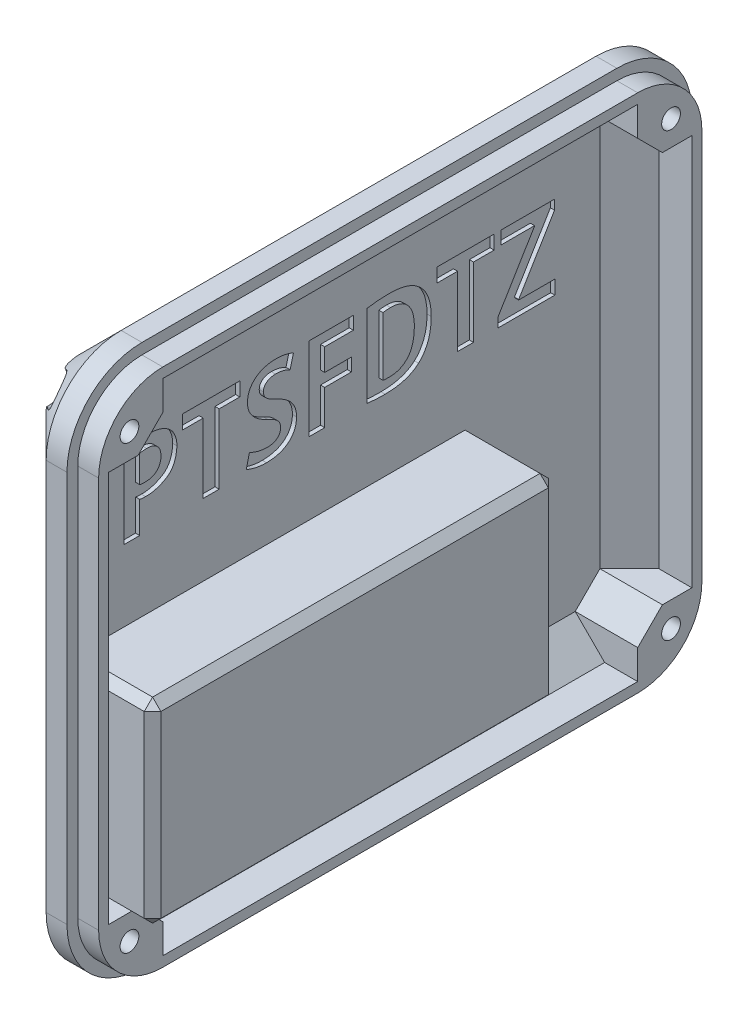
from build123d import *

# Parameters (mm, degrees)
EXTRUDE_4_DEPTH     = 15
CHAMFER_2_SIZE      = 10
SHELL_3_T           = -5
EXTRUDE_5_DEPTH     = 5
EXTRUDE_6_REACH     = 103.242
SKETCH_6_R          = 2.25
CUT_EXTRUDE_1_DEPTH = 43
SKETCH_7_R          = 3.75
CUT_EXTRUDE_2_DEPTH = 16
FILLET_1_R          = 2
SKETCH_8_W          = 93
SKETCH_8_H          = 43
CUT_EXTRUDE_3_DEPTH = 16
SKETCH_12_W         = 97
SKETCH_12_H         = 47
SKETCH_12_W_2       = 93
SKETCH_12_H_2       = 43
EXTRUDE_7_DEPTH     = 18
SKETCH_14_W         = 97
SKETCH_14_H         = 47
EXTRUDE_8_DEPTH     = 2
CHAMFER_4_SIZE      = 2
SKETCH_15_W         = 8
SKETCH_15_H         = 8
CUT_EXTRUDE_4_DEPTH = 3
FILLET_2_R          = 4
CUT_EXTRUDE_5_DEPTH = 1
SKETCH_18_R         = 5
CUT_EXTRUDE_6_DEPTH = 10


with BuildPart() as part:
    # 草图3 → 凸台-拉伸4 (new body)
    with BuildSketch(Plane(origin=(0, 0, 0), x_dir=(0, 0, -1), z_dir=(1, 0, 0))):
        with BuildLine():
            Line((-57, -65), (57, -65))
            ThreePointArc((57, -65), (69.727922061, -59.727922061), (75, -47))
            Line((75, -47), (75, 47))
            ThreePointArc((75, 47), (69.727922061, 59.727922061), (57, 65))
            Line((57, 65), (-57, 65))
            ThreePointArc((-57, 65), (-69.727922061, 59.727922061), (-75, 47))
            Line((-75, 47), (-75, -47))
            ThreePointArc((-75, -47), (-69.727922061, -59.727922061), (-57, -65))
        make_face()
    extrude(amount=EXTRUDE_4_DEPTH)

    # 倒角2
    chamfer_2_edges = [part.edges().sort_by_distance(p)[0] for p in [
        (0, 65, 0),
        (0, 59.727922061, -69.727922061),
        (0, 0, -75),
        (0, -59.727922061, -69.727922061),
        (0, -65, 0),
        (0, -59.727922061, 69.727922061),
        (0, 0, 75),
        (0, 59.727922061, 69.727922061),
    ]]
    chamfer(chamfer_2_edges, length=CHAMFER_2_SIZE)

    # 抽壳3
    shell_3_openings = [part.faces().sort_by_distance(p)[0] for p in [
        (15, 0, 0),
    ]]
    offset(amount=SHELL_3_T, openings=shell_3_openings, kind=Kind.INTERSECTION)

    # 草图4 → 凸台-拉伸5 (add)
    with BuildSketch(Plane(origin=(15, 0, 0), x_dir=(0, 0, -1), z_dir=(1, 0, 0))):
        with BuildLine():
            Line((72.4, -47), (72.4, 47))
            ThreePointArc((72.4, 47), (67.88944443, 57.88944443), (57, 62.4))
            Line((57, 62.4), (-57, 62.4))
            ThreePointArc((-57, 62.4), (-67.88944443, 57.88944443), (-72.4, 47))
            Line((-72.4, 47), (-72.4, -47))
            ThreePointArc((-72.4, -47), (-67.88944443, -57.88944443), (-57, -62.4))
            Line((-57, -62.4), (57, -62.4))
            ThreePointArc((57, -62.4), (67.88944443, -57.88944443), (72.4, -47))
        make_face()
        with BuildLine():
            Line((70, -47), (70, 47))
            ThreePointArc((70, 47), (66.192388155, 56.192388155), (57, 60))
            Line((57, 60), (-57, 60))
            ThreePointArc((-57, 60), (-66.192388155, 56.192388155), (-70, 47))
            Line((-70, 47), (-70, -47))
            ThreePointArc((-70, -47), (-66.192388155, -56.192388155), (-57, -60))
            Line((-57, -60), (57, -60))
            ThreePointArc((57, -60), (66.192388155, -56.192388155), (70, -47))
        make_face(mode=Mode.SUBTRACT)
    extrude(amount=EXTRUDE_5_DEPTH)

    # 草图5 → 凸台-拉伸6 (add, up to next)
    with BuildSketch(Plane(origin=(20, 0, 0), x_dir=(0, 0, -1), z_dir=(1, 0, 0)), mode=Mode.PRIVATE) as extrude_6_sk1:
        with BuildLine():
            Line((-57, 52.928932188), (-62.928932188, 47))
            Line((-62.928932188, 47), (-70, 47))
            ThreePointArc((-70, 47), (-66.192388155, 56.192388155), (-57, 60))
            Line((-57, 60), (-57, 52.928932188))
        make_face()
    extrude_6_tool1 = extrude(extrude_6_sk1.sketch, amount=-EXTRUDE_6_REACH, mode=Mode.PRIVATE) - part.part
    # 草图5 → 凸台-拉伸6 (add, up to next)
    with BuildSketch(Plane(origin=(20, 0, 0), x_dir=(0, 0, -1), z_dir=(1, 0, 0)), mode=Mode.PRIVATE) as extrude_6_sk2:
        with BuildLine():
            Line((57, 60), (57, 52.928932188))
            Line((57, 52.928932188), (62.928932188, 47))
            Line((62.928932188, 47), (70, 47))
            ThreePointArc((70, 47), (66.192388155, 56.192388155), (57, 60))
        make_face()
    extrude_6_tool2 = extrude(extrude_6_sk2.sketch, amount=-EXTRUDE_6_REACH, mode=Mode.PRIVATE) - part.part
    # 草图5 → 凸台-拉伸6 (add, up to next)
    with BuildSketch(Plane(origin=(20, 0, 0), x_dir=(0, 0, -1), z_dir=(1, 0, 0)), mode=Mode.PRIVATE) as extrude_6_sk3:
        with BuildLine():
            Line((62.928932188, -47), (70, -47))
            ThreePointArc((70, -47), (66.192388155, -56.192388155), (57, -60))
            Line((57, -60), (57, -52.928932188))
            Line((57, -52.928932188), (62.928932188, -47))
        make_face()
    extrude_6_tool3 = extrude(extrude_6_sk3.sketch, amount=-EXTRUDE_6_REACH, mode=Mode.PRIVATE) - part.part
    # 草图5 → 凸台-拉伸6 (add, up to next)
    with BuildSketch(Plane(origin=(20, 0, 0), x_dir=(0, 0, -1), z_dir=(1, 0, 0)), mode=Mode.PRIVATE) as extrude_6_sk4:
        with BuildLine():
            Line((-57, -60), (-57, -52.928932188))
            Line((-57, -52.928932188), (-62.928932188, -47))
            Line((-62.928932188, -47), (-70, -47))
            ThreePointArc((-70, -47), (-66.192388155, -56.192388155), (-57, -60))
        make_face()
    extrude_6_tool4 = extrude(extrude_6_sk4.sketch, amount=-EXTRUDE_6_REACH, mode=Mode.PRIVATE) - part.part
    add(extrude_6_tool1.solids().sort_by_distance((20, 53.057838, 63.057838))[0])
    add(extrude_6_tool2.solids().sort_by_distance((20, 53.057838, -63.057838))[0])
    add(extrude_6_tool3.solids().sort_by_distance((20, -53.057838, -63.057838))[0])
    add(extrude_6_tool4.solids().sort_by_distance((20, -53.057838, 63.057838))[0])

    # 草图6 → 切除-拉伸1 (cut)
    with BuildSketch(Plane(origin=(20, 0, 0), x_dir=(0, 0, -1), z_dir=(1, 0, 0))):
        with Locations((65, 53)):
            Circle(SKETCH_6_R)
        with Locations(Location((-65, 53, 0), (0, 0, 347.276950351))):
            Circle(SKETCH_6_R)
        with Locations(Location((65, -53, 0), (0, 0, 118.983255922))):
            Circle(SKETCH_6_R)
        with Locations((-65, -53)):
            Circle(SKETCH_6_R)
    extrude(amount=-CUT_EXTRUDE_1_DEPTH, mode=Mode.SUBTRACT)

    # 草图7 → 切除-拉伸2 (cut)
    with BuildSketch(Plane.ZY):
        with Locations((65, 53)):
            Circle(SKETCH_7_R)
        with Locations(Location((-65, 53, 0), (0, 0, 11.255696593))):
            Circle(SKETCH_7_R)
        with Locations((-65, -53)):
            Circle(SKETCH_7_R)
        with Locations(Location((65, -53, 0), (0, 0, 95.004507954))):
            Circle(SKETCH_7_R)
    extrude(amount=-CUT_EXTRUDE_2_DEPTH, mode=Mode.SUBTRACT)

    # 圆角1
    fillet_1_edges = [part.edges().sort_by_distance(p)[0] for p in [
        (0, -50.75, 62),
        (0, -50.466645488, -62.235110324),
        (0, 50.749999996, -62.000000003),
        (0, 50.75, 62),
    ]]
    fillet(fillet_1_edges, radius=FILLET_1_R)

    # 草图8 → 切除-拉伸3 (cut)
    with BuildSketch(Plane.ZY):
        with Locations((15.948862223, -25.5)):
            Rectangle(SKETCH_8_W, SKETCH_8_H)
    extrude(amount=-CUT_EXTRUDE_3_DEPTH, mode=Mode.SUBTRACT)

    # 草图12 → 凸台-拉伸7 (add)
    with BuildSketch(Plane(origin=(5, 0, 0), x_dir=(0, 0, -1), z_dir=(1, 0, 0))):
        with Locations((-15.948862223, -25.5)):
            Rectangle(SKETCH_12_W, SKETCH_12_H)
        with Locations((-15.948862223, -25.5)):
            Rectangle(SKETCH_12_W_2, SKETCH_12_H_2, mode=Mode.SUBTRACT)
    extrude(amount=EXTRUDE_7_DEPTH)

    # 草图14 → 凸台-拉伸8 (add)
    with BuildSketch(Plane(origin=(23, 0, 0), x_dir=(0, 0, -1), z_dir=(1, 0, 0))):
        with Locations((-15.948862223, -25.5)):
            Rectangle(SKETCH_14_W, SKETCH_14_H)
    extrude(amount=EXTRUDE_8_DEPTH)

    # 倒角4
    chamfer_4_edges = [part.edges().sort_by_distance(p)[0] for p in [
        (25, -2, 15.948862223),
        (15, -2, -32.551137777),
        (25, -25.5, -32.551137777),
        (15, -49, -32.551137777),
        (25, -49, 15.948862223),
        (22.5, -49, 64.448862223),
        (25, -25.5, 64.448862223),
        (15.759965017, -2, 64.448862223),
    ]]
    chamfer(chamfer_4_edges, length=CHAMFER_4_SIZE)

    # 草图15 → 切除-拉伸4 (cut)
    with BuildSketch(Plane.ZY):
        with Locations((-26.551137777, 0)):
            Rectangle(SKETCH_15_W, SKETCH_15_H)
        with Locations((-26.551137777, -51)):
            Rectangle(SKETCH_15_W, SKETCH_15_H)
        with Locations((58.448862223, 0)):
            Rectangle(SKETCH_15_W, SKETCH_15_H)
    extrude(amount=-CUT_EXTRUDE_4_DEPTH, mode=Mode.SUBTRACT)

    # 圆角2
    fillet_2_edges = [part.edges().sort_by_distance(p)[0] for p in [
        (1.5, 4, 62.448862223),
        (1.5, 4, 54.448862223),
        (1.5, -55, -22.551137777),
        (1.5, -55, -30.551137777),
        (1.5, 4, -22.551137777),
        (1.5, 4, -30.551137777),
    ]]
    fillet(fillet_2_edges, radius=FILLET_2_R - 0.0001)  # a hair under: the kernel refuses the full size

    # 草图17 → 切除-拉伸5 (cut)
    # profile 1 of 7: a face of its own
    with BuildSketch(Plane(origin=(5, 0, 0), x_dir=(0, 0, -1), z_dir=(1, 0, 0))):
        with BuildLine():
            Line((-47.531376496, 15.129092572), (-47.531376496, 22.636782727))
            add(Edge.make_bspline(
                [(-47.531376496, 22.636782727), (-47.431098368, 22.617120371), (-47.220487538, 22.575824176), (-46.886676425, 22.554096358), (-46.525052893, 22.525550993), (-46.274542663, 22.52678871), (-46.143744265, 22.527434956)],
                knots=[0, 0, 0, 0, 0.878556077, 1.845202224, 2.874919808, 4, 4, 4, 4], degree=3))
            add(Edge.make_bspline(
                [(-46.143744265, 22.527434956), (-45.942578141, 22.524349056), (-45.538427119, 22.518149357), (-44.930521662, 22.565113241), (-44.320415079, 22.659813761), (-43.709664431, 22.804397059), (-43.097611162, 22.993777707), (-42.483672295, 23.228252537), (-41.870649894, 23.513633312), (-41.257844936, 23.834006396), (-40.670896884, 24.218397257), (-40.160004138, 24.706885405), (-39.712251922, 25.268947772), (-39.34725831, 25.920470025), (-39.047614632, 26.650757383), (-38.825933064, 27.465364563), (-38.669471039, 28.360544143), (-38.627722313, 28.986063161), (-38.606035486, 29.310995783)],
                knots=[0, 0, 0, 0, 0.841321464, 1.69024945, 2.54697463, 3.421933785, 4.313421963, 5.225513963, 6.16898692, 7.140527675, 8.117658811, 9.092268315, 10.084297122, 11.113479625, 12.205185911, 13.378908979, 14.638445907, 16, 16, 16, 16], degree=3))
            add(Edge.make_bspline(
                [(-38.606035486, 29.310995783), (-38.612526169, 29.540130121), (-38.625283468, 29.990488742), (-38.726361821, 30.647303787), (-38.883743131, 31.272375099), (-39.10651365, 31.860011709), (-39.385293054, 32.407301896), (-39.714220411, 32.907586877), (-40.092543092, 33.360608829), (-40.386004413, 33.617040303), (-40.532883503, 33.745385739)],
                knots=[0, 0, 0, 0, 1.10039744, 2.162807532, 3.18512533, 4.192295778, 5.175353367, 6.130031606, 7.064069995, 8, 8, 8, 8], degree=3))
            add(Edge.make_bspline(
                [(-40.532883503, 33.745385739), (-40.699914857, 33.870042195), (-41.038923022, 34.12304593), (-41.608900188, 34.435279131), (-42.233419418, 34.698879307), (-42.915574426, 34.912468378), (-43.654365671, 35.079317638), (-44.450581923, 35.187026778), (-45.302819401, 35.258085271), (-45.889689663, 35.262641113), (-46.192763882, 35.264993862)],
                knots=[0, 0, 0, 0, 0.836606025, 1.697982253, 2.603178176, 3.556730869, 4.566307281, 5.642647, 6.782605007, 8, 8, 8, 8], degree=3))
            add(Edge.make_bspline(
                [(-46.192763882, 35.264993862), (-46.460515862, 35.262563527), (-46.979807146, 35.257850016), (-47.737696861, 35.228876833), (-48.450409453, 35.195450545), (-49.120861549, 35.156705954), (-49.744130697, 35.098472879), (-50.325157891, 35.03511437), (-50.861345811, 34.962363806), (-51.203025999, 34.899223281), (-51.366218831, 34.869066188)],
                knots=[0, 0, 0, 0, 1.236942669, 2.398987101, 3.50349081, 4.533253662, 5.501087568, 6.394974819, 7.233410034, 8, 8, 8, 8], degree=3))
            Line((-51.366218831, 34.869066188), (-51.362451774, 15.129092572))
            Line((-51.362451774, 15.129092572), (-47.531376496, 15.129092572))
        make_face()
        with BuildLine():
            add(Edge.make_bspline(
                [(-47.531376496, 32.24597906), (-47.436133136, 32.26730815), (-47.218480606, 32.316049924), (-46.84570017, 32.354010806), (-46.392042729, 32.390817723), (-46.062158321, 32.396276393), (-45.883563221, 32.399231645)],
                knots=[0, 0, 0, 0, 0.70585537, 1.613038518, 2.7077303, 4, 4, 4, 4], degree=3))
            add(Edge.make_bspline(
                [(-45.883563221, 32.399231645), (-45.753958765, 32.397880525), (-45.500319557, 32.395236349), (-45.131402378, 32.350666396), (-44.782807657, 32.28892127), (-44.456930876, 32.198307515), (-44.152544756, 32.080785575), (-43.870083065, 31.937261047), (-43.605477223, 31.770438878), (-43.365875026, 31.574661416), (-43.148119981, 31.354579761), (-42.959601932, 31.108803282), (-42.798937998, 30.838370383), (-42.672256994, 30.542055152), (-42.569763173, 30.222717018), (-42.494676888, 29.87943669), (-42.449731936, 29.51074357), (-42.441403123, 29.25707367), (-42.437107081, 29.126229535)],
                knots=[0, 0, 0, 0, 1.150647283, 2.251845908, 3.296564491, 4.293585939, 5.251638342, 6.190496202, 7.10431693, 8.025138136, 8.933209785, 9.848938853, 10.770098533, 11.720244083, 12.705502524, 13.745915437, 14.837332513, 16, 16, 16, 16], degree=3))
            add(Edge.make_bspline(
                [(-42.437107081, 29.126229535), (-42.441621439, 28.992908464), (-42.450462655, 28.731803663), (-42.493210792, 28.351177217), (-42.574622616, 27.993235399), (-42.681493447, 27.657333), (-42.824586828, 27.34588755), (-42.988684058, 27.052042089), (-43.190956056, 26.78398796), (-43.420846504, 26.538460466), (-43.679134903, 26.318803293), (-43.962765135, 26.125147736), (-44.273376016, 25.963445969), (-44.609719313, 25.830506117), (-44.969591882, 25.726292616), (-45.355547829, 25.650056039), (-45.765670662, 25.606021971), (-46.048116589, 25.597440934), (-46.192763882, 25.59304638)],
                knots=[0, 0, 0, 0, 1.095951735, 2.146384348, 3.141117811, 4.107846426, 5.036936284, 5.952845255, 6.867880406, 7.788493674, 8.711536769, 9.648229827, 10.604475232, 11.582556545, 12.615324965, 13.678675286, 14.811194273, 16, 16, 16, 16], degree=3))
            add(Edge.make_bspline(
                [(-46.192763882, 25.59304638), (-46.32353131, 25.592913513), (-46.572653992, 25.592660391), (-46.927117352, 25.613875596), (-47.244205621, 25.638258816), (-47.43986216, 25.676820102), (-47.531376496, 25.694856354)],
                knots=[0, 0, 0, 0, 1.166410307, 2.222107342, 3.16842715, 4, 4, 4, 4], degree=3))
            Line((-47.531376496, 25.694856354), (-47.531376496, 32.24597906))
        make_face(mode=Mode.SUBTRACT)
    # profile 2 of 7: a face of its own
    with BuildSketch(Plane(origin=(5, 0, 0), x_dir=(0, 0, -1), z_dir=(1, 0, 0))):
        Polygon((-37.223643257, 35.262629785), (-37.223643257, 31.926467783), (-32.297591552, 31.926467783), (-32.297591552, 15.219594008), (-28.466516274, 15.219594008), (-28.466516274, 31.926467783), (-23.514400802, 31.926467783), (-23.514400802, 35.262629785), align=None)
    # profile 3 of 7: a face of its own
    with BuildSketch(Plane(origin=(5, 0, 0), x_dir=(0, 0, -1), z_dir=(1, 0, 0))):
        with BuildLine():
            add(Edge.make_bspline(
                [(-21.939826046, 16.104948238), (-21.807842573, 16.031918354), (-21.526202442, 15.876079556), (-21.045795793, 15.691517494), (-20.498630994, 15.507650217), (-19.882719081, 15.351836306), (-19.221841735, 15.211715906), (-18.527920853, 15.110843521), (-17.811628749, 15.045324002), (-17.32537909, 15.033451938), (-17.078882201, 15.027433575)],
                knots=[0, 0, 0, 0, 0.719594672, 1.535546325, 2.452393094, 3.475924305, 4.567249392, 5.677640584, 6.822715122, 8, 8, 8, 8], degree=3))
            add(Edge.make_bspline(
                [(-17.078882201, 15.027433575), (-16.798317969, 15.034485899), (-16.252181538, 15.048213704), (-15.460271956, 15.138848922), (-14.716452534, 15.266072746), (-14.025173056, 15.453477526), (-13.380029229, 15.679660211), (-12.78829, 15.965097091), (-12.24560471, 16.297753411), (-11.754116299, 16.67780444), (-11.321857273, 17.103502487), (-10.935033987, 17.554010257), (-10.619680285, 18.047149933), (-10.350442289, 18.56504287), (-10.149457503, 19.121409319), (-9.995052823, 19.70741077), (-9.91076355, 20.329205456), (-9.89574045, 20.753704412), (-9.888081481, 20.970119436)],
                knots=[0, 0, 0, 0, 1.280827998, 2.493214574, 3.635842522, 4.723067123, 5.759595453, 6.75296466, 7.716578851, 8.661346905, 9.582605015, 10.482742654, 11.366187061, 12.249109382, 13.142470757, 14.061151216, 15.011549973, 16, 16, 16, 16], degree=3))
            add(Edge.make_bspline(
                [(-9.888081481, 20.970119436), (-9.890774353, 21.132357676), (-9.896089412, 21.452575477), (-9.944328686, 21.924718287), (-10.034195144, 22.378655172), (-10.147243196, 22.819911596), (-10.309095283, 23.240228192), (-10.496626889, 23.648271189), (-10.72527928, 24.036543796), (-10.985740416, 24.412397569), (-11.286614766, 24.771426811), (-11.623602985, 25.119984883), (-12.000678012, 25.45504337), (-12.419190136, 25.774738977), (-12.870842923, 26.08980387), (-13.36582173, 26.385983749), (-13.899581179, 26.668793408), (-14.271485377, 26.845112441), (-14.461988809, 26.935429734)],
                knots=[0, 0, 0, 0, 0.971604692, 1.917705205, 2.837533086, 3.741450306, 4.641944002, 5.53106885, 6.428441787, 7.336893241, 8.26704506, 9.230684205, 10.238479509, 11.285007773, 12.38342881, 13.535071349, 14.737370079, 16, 16, 16, 16], degree=3))
            add(Edge.make_bspline(
                [(-14.461988809, 26.935429734), (-14.606803587, 27.001465809), (-14.887673895, 27.12954371), (-15.290476394, 27.324730862), (-15.661179956, 27.517572326), (-16.000656933, 27.706161684), (-16.311798273, 27.889581104), (-16.588779993, 28.075404151), (-16.839252194, 28.250430041), (-17.057596446, 28.426290206), (-17.249643761, 28.603854691), (-17.413056959, 28.793433793), (-17.550375476, 28.996144587), (-17.662987388, 29.208112147), (-17.747605941, 29.432783233), (-17.806521611, 29.666804537), (-17.847708496, 29.912873894), (-17.847976727, 30.081310089), (-17.848113112, 30.166953708)],
                knots=[0, 0, 0, 0, 1.534293153, 2.975783242, 4.314400128, 5.561899513, 6.719353789, 7.794748337, 8.776507069, 9.664015056, 10.495494951, 11.294559956, 12.0708857, 12.851360931, 13.602992373, 14.37884518, 15.175702311, 16, 16, 16, 16], degree=3))
            add(Edge.make_bspline(
                [(-17.848113112, 30.166953708), (-17.840650914, 30.309978927), (-17.825872088, 30.593239291), (-17.690456298, 31.003377169), (-17.466328199, 31.382997307), (-17.20915899, 31.665553387), (-16.962560201, 31.870488914), (-16.745896444, 32.004684767), (-16.507095163, 32.124140812), (-16.240794063, 32.214705202), (-15.953494944, 32.296648469), (-15.640137634, 32.351498983), (-15.302221518, 32.38406366), (-15.069144906, 32.39405583), (-14.948414237, 32.399231645)],
                knots=[0, 0, 0, 0, 1.252807395, 2.481175558, 3.747276352, 5.098962457, 5.812468956, 6.556386487, 7.331171674, 8.151379655, 9.021437812, 9.952148669, 10.939239512, 12, 12, 12, 12], degree=3))
            add(Edge.make_bspline(
                [(-14.948414237, 32.399231645), (-14.752207364, 32.392736556), (-14.372839786, 32.380178248), (-13.82451522, 32.324478258), (-13.317856598, 32.234617488), (-12.853683249, 32.113758851), (-12.434988322, 31.971597467), (-12.057246028, 31.835103205), (-11.725683184, 31.691997713), (-11.525245924, 31.58595609), (-11.430314042, 31.535732241)],
                knots=[0, 0, 0, 0, 1.287765497, 2.48990501, 3.61253477, 4.660633034, 5.633348447, 6.512647364, 7.29555421, 8, 8, 8, 8], degree=3))
            Line((-11.430314042, 31.535732241), (-10.629911928, 34.625963944))
            add(Edge.make_bspline(
                [(-10.629911928, 34.625963944), (-10.754228173, 34.682847315), (-11.013527544, 34.801494901), (-11.430349328, 34.967708406), (-11.898464275, 35.103501149), (-12.406622232, 35.2443895), (-12.962285892, 35.35491384), (-13.56086465, 35.444057167), (-14.203664134, 35.489290436), (-14.645446722, 35.500531286), (-14.872999442, 35.506321207)],
                knots=[0, 0, 0, 0, 0.751083297, 1.566612858, 2.462144976, 3.426904781, 4.462872615, 5.572206229, 6.749495582, 8, 8, 8, 8], degree=3))
            add(Edge.make_bspline(
                [(-14.872999442, 35.506321207), (-15.134649474, 35.497160231), (-15.644116408, 35.47932261), (-16.384166613, 35.396711779), (-17.079154235, 35.265419328), (-17.728576012, 35.084366504), (-18.335788186, 34.85931039), (-18.897063505, 34.583074481), (-19.413616955, 34.257893795), (-19.880198575, 33.883351288), (-20.299764299, 33.473842618), (-20.662648983, 33.029547871), (-20.975679815, 32.560170242), (-21.229797635, 32.058886907), (-21.425407161, 31.528007354), (-21.568627718, 30.96966491), (-21.662239638, 30.382455304), (-21.675958727, 29.980032149), (-21.682955447, 29.774796773)],
                knots=[0, 0, 0, 0, 1.256955866, 2.447457956, 3.572082846, 4.649959342, 5.681406033, 6.67750641, 7.648772353, 8.6065338, 9.545567091, 10.459092244, 11.356420819, 12.24994494, 13.151405518, 14.067877277, 15.01461949, 16, 16, 16, 16], degree=3))
            add(Edge.make_bspline(
                [(-21.682955447, 29.774796773), (-21.676952653, 29.613691446), (-21.665089013, 29.295290484), (-21.59880307, 28.826145355), (-21.498868664, 28.372357415), (-21.3544997, 27.935298708), (-21.167146109, 27.517156909), (-20.9500603, 27.110633522), (-20.686802879, 26.724123629), (-20.383884077, 26.355697527), (-20.04887225, 26.002748632), (-19.683221146, 25.664453074), (-19.287934653, 25.340643194), (-18.859415869, 25.032363623), (-18.4043365, 24.731570614), (-17.911842809, 24.456999765), (-17.395072843, 24.184758651), (-17.033360697, 24.023641309), (-16.848867076, 23.941462366)],
                knots=[0, 0, 0, 0, 0.960729928, 1.898741275, 2.820565259, 3.728266954, 4.637606962, 5.549753057, 6.472673147, 7.420779733, 8.390934511, 9.372027768, 10.389211705, 11.435574366, 12.518575566, 13.639649148, 14.796087777, 16, 16, 16, 16], degree=3))
            add(Edge.make_bspline(
                [(-16.848867076, 23.941462366), (-16.593139391, 23.825761912), (-16.111752776, 23.607965198), (-15.458355579, 23.244154241), (-14.910206722, 22.879386301), (-14.469921148, 22.497110295), (-14.121736435, 22.095372974), (-13.886673148, 21.648779951), (-13.737347111, 21.165659993), (-13.725309241, 20.829209021), (-13.719153076, 20.657148036)],
                knots=[0, 0, 0, 0, 1.393665495, 2.6234622, 3.710952145, 4.657720235, 5.513058752, 6.334242817, 7.148131986, 8, 8, 8, 8], degree=3))
            add(Edge.make_bspline(
                [(-13.719153076, 20.657148036), (-13.720925921, 20.563997956), (-13.724391416, 20.381911401), (-13.763172733, 20.116438817), (-13.826433803, 19.865603996), (-13.919308494, 19.630362855), (-14.031198195, 19.406196799), (-14.172295852, 19.197517189), (-14.339536436, 19.004104153), (-14.531968578, 18.827198751), (-14.748375119, 18.668272059), (-14.988243333, 18.527645353), (-15.252185565, 18.407427802), (-15.540252518, 18.309387762), (-15.85235426, 18.235097608), (-16.187298192, 18.178268576), (-16.547832468, 18.145179444), (-16.796012042, 18.138154123), (-16.924281871, 18.134523137)],
                knots=[0, 0, 0, 0, 0.969766496, 1.895666023, 2.788091005, 3.658633537, 4.525326931, 5.393305268, 6.275294433, 7.18343149, 8.110533905, 9.067217099, 10.075045017, 11.126827756, 12.232027601, 13.413846859, 14.663365337, 16, 16, 16, 16], degree=3))
            add(Edge.make_bspline(
                [(-16.924281871, 18.134523137), (-17.125511515, 18.141026776), (-17.525030793, 18.153939036), (-18.118821, 18.213679928), (-18.700538415, 18.316584843), (-19.265799657, 18.4550438), (-19.803766617, 18.624229256), (-20.30729965, 18.811352948), (-20.7691972, 19.021001661), (-21.054333925, 19.183221462), (-21.192759279, 19.261974325)],
                knots=[0, 0, 0, 0, 1.082450425, 2.149086012, 3.20582521, 4.256603573, 5.276294291, 6.236645749, 7.143944243, 8, 8, 8, 8], degree=3))
            Line((-21.192759279, 19.261974325), (-21.939826046, 16.104948238))
        make_face()
    # profile 4 of 7: a face of its own
    with BuildSketch(Plane(origin=(5, 0, 0), x_dir=(0, 0, -1), z_dir=(1, 0, 0))):
        Polygon((-3.127145093, 23.715214298), (3.284541255, 23.715214298), (3.284541255, 26.822303859), (-3.127145093, 26.822303859), (-3.127145093, 32.161667676), (3.753689036, 32.161667676), (3.753689036, 35.26876092), (-6.95822037, 35.26876092), (-6.95822037, 15.348745527), (-3.127145093, 15.348745527), align=None)
    # profile 5 of 7: a face of its own
    with BuildSketch(Plane(origin=(5, 0, 0), x_dir=(0, 0, -1), z_dir=(1, 0, 0))):
        with BuildLine():
            add(Edge.make_bspline(
                [(7.038765616, 15.30385384), (7.173174325, 15.28522788), (7.456627232, 15.245947819), (7.901752218, 15.1979376), (8.3871917, 15.157563639), (8.91123158, 15.118838709), (9.474473982, 15.089704899), (10.076589421, 15.066815155), (10.716458631, 15.052925233), (11.156413928, 15.046051408), (11.3826615, 15.042516534)],
                knots=[0, 0, 0, 0, 0.747798485, 1.577023202, 2.466955376, 3.432305679, 4.472841868, 5.575028817, 6.752955478, 8, 8, 8, 8], degree=3))
            add(Edge.make_bspline(
                [(11.3826615, 15.042516534), (11.803996533, 15.049372111), (12.625630816, 15.062740989), (13.821410086, 15.177490515), (14.947936751, 15.363002116), (16.000106776, 15.629905004), (16.978826337, 15.969560469), (17.872793643, 16.39622191), (18.694480049, 16.887616573), (19.174048863, 17.290854521), (19.410566448, 17.489726638)],
                knots=[0, 0, 0, 0, 1.17842423, 2.298013867, 3.356996017, 4.369259479, 5.331192529, 6.249700563, 7.136773321, 8, 8, 8, 8], degree=3))
            add(Edge.make_bspline(
                [(19.410566448, 17.489726638), (19.50962324, 17.579133229), (19.710976085, 17.7608701), (19.999728015, 18.059601447), (20.271641251, 18.393691817), (20.543726222, 18.750416715), (20.791406842, 19.146591173), (21.044587797, 19.56407577), (21.278690343, 20.016656757), (21.507569366, 20.497952973), (21.721229188, 21.012892972), (21.898533066, 21.570465668), (22.05971047, 22.162082934), (22.183732405, 22.794095246), (22.29266602, 23.462612484), (22.362942815, 24.170498415), (22.420023278, 24.915954687), (22.429723162, 25.425757865), (22.434699734, 25.687314874)],
                knots=[0, 0, 0, 0, 0.711529635, 1.446327024, 2.212730038, 3.007707617, 3.836959069, 4.702581573, 5.611055214, 6.552559085, 7.54462654, 8.581167827, 9.670545423, 10.812911411, 12.014096724, 13.281372547, 14.605194915, 16, 16, 16, 16], degree=3))
            add(Edge.make_bspline(
                [(22.434699734, 25.687314874), (22.431287251, 25.909833549), (22.424611654, 26.34513085), (22.387460039, 26.985643777), (22.322161703, 27.600544815), (22.238281882, 28.191333743), (22.123273249, 28.755858679), (21.988434578, 29.29469127), (21.831302176, 29.809282373), (21.645152481, 30.297053513), (21.437129857, 30.760783601), (21.211777452, 31.204033601), (20.961775662, 31.622219554), (20.694247272, 32.02017582), (20.404547322, 32.393239803), (20.092066619, 32.740779349), (19.76578297, 33.072154644), (19.529065556, 33.272027518), (19.410566448, 33.372082503)],
                knots=[0, 0, 0, 0, 1.250196122, 2.445668869, 3.60292861, 4.723409941, 5.796680955, 6.837975795, 7.843086112, 8.817515314, 9.76895262, 10.69744629, 11.609358382, 12.504409608, 13.39005195, 14.260302496, 15.129119398, 16, 16, 16, 16], degree=3))
            add(Edge.make_bspline(
                [(19.410566448, 33.372082503), (19.197935703, 33.541703597), (18.768235488, 33.884486673), (18.047767431, 34.313676562), (17.262987547, 34.674714288), (16.410512843, 34.976050341), (15.480423228, 35.202823768), (14.467077422, 35.368405675), (13.366677008, 35.464648192), (12.603316045, 35.477202711), (12.208453508, 35.483696768)],
                knots=[0, 0, 0, 0, 0.850789701, 1.719339872, 2.61723906, 3.551911928, 4.545442216, 5.610282156, 6.763874371, 8, 8, 8, 8], degree=3))
            add(Edge.make_bspline(
                [(12.208453508, 35.483696768), (11.731938721, 35.479397892), (10.802030683, 35.471008729), (9.658259431, 35.397330663), (8.787288882, 35.319135941), (8.175653708, 35.240793868), (7.594174147, 35.160800759), (7.218321711, 35.09397055), (7.034998558, 35.061373915)],
                knots=[0, 0, 0, 0, 1.650018419, 3.219974348, 3.967566001, 4.678084243, 5.355231624, 6, 6, 6, 6], degree=3))
            Line((7.034998558, 35.061373915), (7.038765616, 15.30385384))
        make_face()
        with BuildLine():
            add(Edge.make_bspline(
                [(10.869840893, 32.269251595), (10.984007582, 32.290168595), (11.235033009, 32.336160109), (11.651041427, 32.376510662), (12.137470336, 32.412923519), (12.486140425, 32.418747398), (12.672254498, 32.421856084)],
                knots=[0, 0, 0, 0, 0.76869223, 1.690171609, 2.76705349, 4, 4, 4, 4], degree=3))
            add(Edge.make_bspline(
                [(12.672254498, 32.421856084), (12.889933938, 32.417018251), (13.314236243, 32.407588311), (13.931965844, 32.327635224), (14.511866759, 32.193935007), (15.059516822, 32.018204456), (15.563603907, 31.769344695), (16.038096889, 31.482551727), (16.470821881, 31.133439073), (16.868810444, 30.737155227), (17.22566635, 30.284872248), (17.535853914, 29.777277105), (17.792756857, 29.214457092), (18.01714795, 28.603690104), (18.175554322, 27.934347282), (18.30254219, 27.215873189), (18.376659289, 26.442965454), (18.389567662, 25.909940132), (18.396237452, 25.634524518)],
                knots=[0, 0, 0, 0, 1.034636826, 2.016721417, 2.954616098, 3.861659027, 4.743652532, 5.62095741, 6.492606741, 7.379948462, 8.28614458, 9.224914536, 10.200706863, 11.223314941, 12.31319917, 13.465574242, 14.690455408, 16, 16, 16, 16], degree=3))
            add(Edge.make_bspline(
                [(18.396237452, 25.634524518), (18.388661361, 25.317610685), (18.374023805, 24.705310319), (18.292047105, 23.81934912), (18.156038075, 23.000834578), (17.978517216, 22.245078149), (17.744931548, 21.556866943), (17.462709454, 20.931995364), (17.126516169, 20.375485441), (16.742396866, 19.883320697), (16.314569575, 19.456742489), (15.85100884, 19.088352077), (15.354193176, 18.775241217), (14.817500906, 18.525993736), (14.246750582, 18.334618502), (13.641952518, 18.19750366), (13.00102617, 18.12197642), (12.561841134, 18.117807143), (12.33665866, 18.115669438)],
                knots=[0, 0, 0, 0, 1.382790342, 2.671650606, 3.877892401, 5.000458499, 6.054825918, 7.043745429, 7.986092149, 8.88452668, 9.760866288, 10.615577842, 11.46308158, 12.316807429, 13.190810493, 14.084799087, 15.018022824, 16, 16, 16, 16], degree=3))
            add(Edge.make_bspline(
                [(12.33665866, 18.115669438), (12.202147822, 18.112796649), (11.941830886, 18.107236982), (11.563368842, 18.125566833), (11.208220703, 18.148607932), (10.980318983, 18.179755713), (10.869840893, 18.194854973)],
                knots=[0, 0, 0, 0, 1.0974001, 2.123783006, 3.090481336, 4, 4, 4, 4], degree=3))
            Line((10.869840893, 18.194854973), (10.869840893, 32.269251595))
        make_face(mode=Mode.SUBTRACT)
    # profile 6 of 7: a face of its own
    with BuildSketch(Plane(origin=(5, 0, 0), x_dir=(0, 0, -1), z_dir=(1, 0, 0))):
        Polygon((23.832174922, 35.262629785), (23.832174922, 31.926467783), (28.758226628, 31.926467783), (28.758226628, 15.219594008), (32.589301906, 15.219594008), (32.589301906, 31.926467783), (37.541417377, 31.926467783), (37.541417377, 35.262629785), align=None)
    # profile 7 of 7: a face of its own
    with BuildSketch(Plane(origin=(5, 0, 0), x_dir=(0, 0, -1), z_dir=(1, 0, 0))):
        Polygon((39.216859422, 35.26876092), (39.216859422, 32.161667676), (47.232001299, 32.161667676), (47.232001299, 32.058053344), (38.43394485, 17.490139063), (38.43394485, 15.274888372), (52.114188696, 15.274888372), (52.114188696, 18.611050374), (43.420240015, 18.611050374), (43.420240015, 18.715290707), (52.035864834, 32.963539053), (52.035864834, 35.26876092), align=None)
    extrude(amount=-CUT_EXTRUDE_5_DEPTH, mode=Mode.SUBTRACT)

    # 草图18 → 切除-拉伸6 (cut)
    with BuildSketch(Plane.XY.offset(-30.551137777)):
        with Locations((12, -12)):
            Circle(SKETCH_18_R)
    extrude(amount=-CUT_EXTRUDE_6_DEPTH, mode=Mode.SUBTRACT)


solid = part.part
